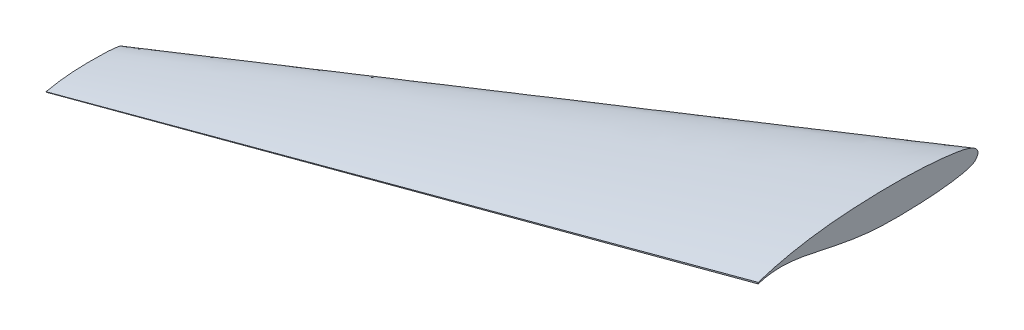
from build123d import *


with BuildPart() as part:
    # Surface-Knit1: read off the stored shape, not the designer's step
    # Surface-Knit1: loft between two sections, ruled curve by curve
    surface_knit1_from = [
        Edge.make_bspline([(0, 0, 0), (0, -177.788302382, 25.820408102), (0, -246.485948711, 171.085912968), (0, -311.912015005, 377.444308178), (0, -347.095913963, 511.994999324), (0, -373.198588528, 653.061349224), (0, -464.310856576, 1213.162920256), (0, -499.101668503, 1735.120095555), (0, -531.724252638, 2737.332944749), (0, -531.330006107, 3247.873743507), (0, -434.932009966, 4240.802429489), (0, -335.77331796, 4741.452899859), (0, -174.510415983, 5488.488769263), (0, -5.08441115, 6242.801482391), (0, 37.313145435, 6997.034292399), (0, -122.099983024, 7497.117661908)], [0, 0, 0, 0, 0.054621792, 0.056802295, 0.080841761, 0.108219423, 0.113833769, 0.306383442, 0.310212468, 0.503114766, 0.505594282, 0.701848022, 0.702801295, 0.801775017, 1, 1, 1, 1], 3),
        Edge.make_bspline([(0, -75.543984205, 7497.117661908), (0, 163.349577431, 6765.363199445), (0, 310.94598773, 6007.120139596), (0, 456.576748472, 4745.804682195), (0, 489.543428573, 4237.738441047), (0, 526.225751025, 3243.056825214), (0, 530.700398686, 2732.256248216), (0, 495.049999949, 1727.189860939), (0, 452.863049778, 1190.050884663), (0, 369.203265791, 644.1192321), (0, 344.239306001, 506.474796897), (0, 305.836809673, 368.016044217), (0, 232.571763356, 155.007504072), (0, 147.744350316, -1.875966356), (0, 0, 0)], [0, 0, 0, 0, 0.300306214, 0.300506353, 0.495240719, 0.498599859, 0.690406648, 0.696246132, 0.886629084, 0.894559474, 0.92202572, 0.943636509, 0.948318104, 1, 1, 1, 1], 3),
        Edge.make_line((0, -75.543984205, 7497.117661908), (0, -122.099983024, 7497.117661908)),
    ]
    surface_knit1_to = [
        Edge.make_bspline([(-17711.940475464, 0, 11444.27522144), (-17711.940475464, -47.81855713, 11446.997227722), (-17711.940475464, -63.090388451, 11514.993754627), (-17711.940475464, -78.388663412, 11590.348755174), (-17711.940475464, -86.639703649, 11634.455499089), (-17711.940475464, -93.272964387, 11685.316894583), (-17711.940475464, -116.962708154, 11886.098931664), (-17711.940475464, -124.768790117, 12064.06661987), (-17711.940475464, -131.747537065, 12408.739619563), (-17711.940475464, -131.076895393, 12585.962177056), (-17711.940475464, -110.923731359, 12933.172314088), (-17711.940475464, -90.891834176, 13109.573622443), (-17711.940475464, -48.208778237, 13368.839197142), (-17711.940475464, 1.18684816, 13628.653013091), (-17711.940475464, 11.648398573, 13895.102644676), (-17711.940475464, -29.371981906, 14068.266403108)], [0, 0, 0, 0, 0.054621792, 0.056802295, 0.080841761, 0.108219423, 0.113833769, 0.306383442, 0.310212468, 0.503114766, 0.505594282, 0.701848022, 0.702801295, 0.801775017, 1, 1, 1, 1], 3),
        Edge.make_bspline([(-17711.940475464, -15.813051437, 14068.266403108), (-17711.940475464, 41.394457396, 13808.849717499), (-17711.940475464, 81.329497509, 13545.112740161), (-17711.940475464, 118.313912796, 13108.497152444), (-17711.940475464, 125.638180272, 12933.165113035), (-17711.940475464, 132.289914098, 12587.918884422), (-17711.940475464, 131.845992854, 12409.687296129), (-17711.940475464, 126.798865745, 12067.313518028), (-17711.940475464, 122.008531396, 11888.099596415), (-17711.940475464, 95.206016213, 11687.320742354), (-17711.940475464, 87.433569672, 11636.50274452), (-17711.940475464, 82.816699427, 11592.776350498), (-17711.940475464, 62.894137111, 11520.282031444), (-17711.940475464, 22.850952251, 11449.683428606), (-17711.940475464, 0, 11444.27522144)], [0, 0, 0, 0, 0.300306214, 0.300506353, 0.495240719, 0.498599859, 0.690406648, 0.696246132, 0.886629084, 0.894559474, 0.92202572, 0.943636509, 0.948318104, 1, 1, 1, 1], 3),
        Edge.make_line((-17711.940475464, -15.813051437, 14068.266403108), (-17711.940475464, -29.371981906, 14068.266403108)),
    ]
    surface_knit1 = Solid(Shell([*[Face.make_surface_from_curves(surface_knit1_from[k], surface_knit1_to[k]) for k in range(3)], Face(Wire(surface_knit1_from)), Face(Wire(surface_knit1_to))]))
    add(surface_knit1)


solid = part.part
